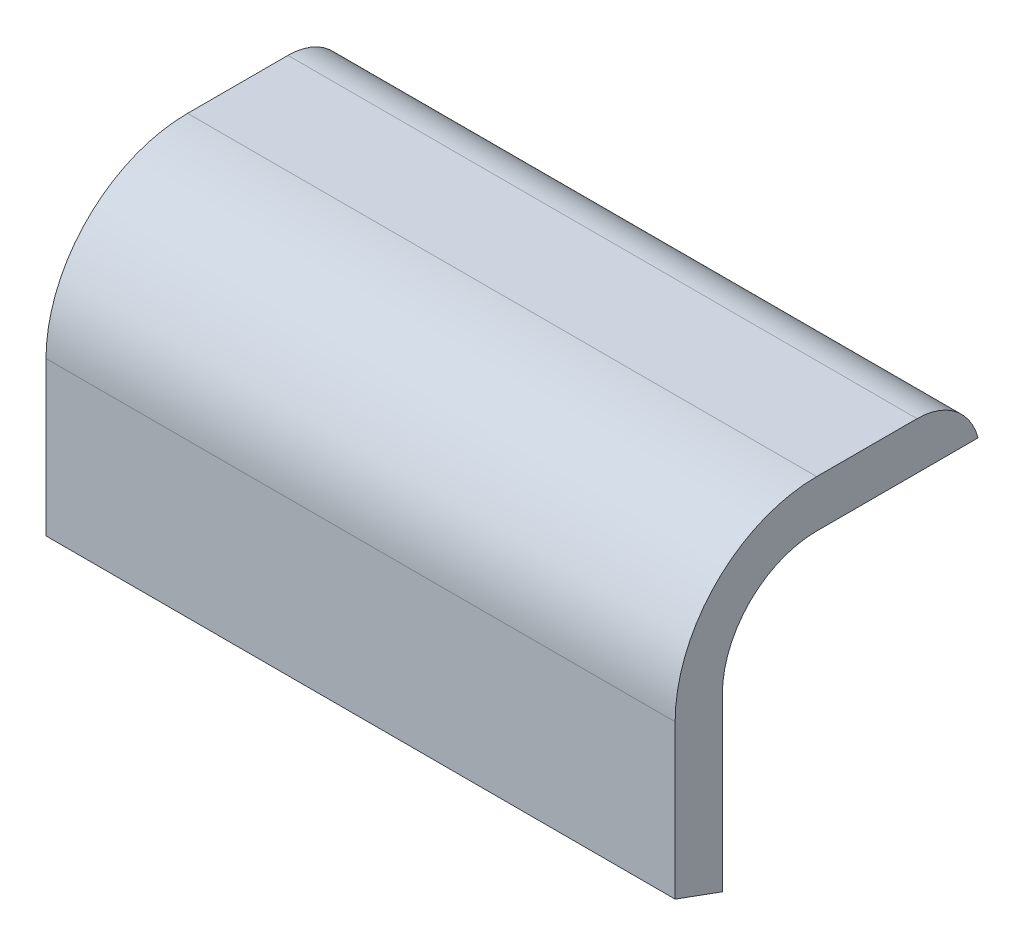
from build123d import *

# Parameters (mm, degrees)
SKETCH1_W           = 100
SKETCH1_H           = 40.64
BOSS_EXTRUDE1_DEPTH = 7.5
SKETCH2_W           = 100
SKETCH2_H           = 7.5
BOSS_EXTRUDE2_DEPTH = 46.92
BOSS_EXTRUDE3_DEPTH = 100
FILLET1_R           = 10
FILLET2_R           = 15
FILLET3_R           = 22.5


with BuildPart() as part:
    # Sketch1 → Boss-Extrude1 (new body)
    with BuildSketch(Plane(origin=(0, 0, 0), x_dir=(1, 0, 0), z_dir=(0, 1, 0))):
        Rectangle(SKETCH1_W, SKETCH1_H)
    extrude(amount=BOSS_EXTRUDE1_DEPTH)

    # Sketch2 → Boss-Extrude2 (add)
    with BuildSketch(Plane(origin=(0, 7.5, 0), x_dir=(1, 0, 0), z_dir=(0, 1, 0))):
        with Locations((0, -24.07)):
            Rectangle(SKETCH2_W, SKETCH2_H)
    extrude(amount=-BOSS_EXTRUDE2_DEPTH)

    # Sketch3 → Boss-Extrude3 (add)
    with BuildSketch(Plane.ZY.offset(50)):
        Polygon((20.32, -39.42), (20.32, -42.16), (27.82, -39.42), (27.82, -32.266971567), (20.32, -32.266971567), align=None)
    extrude(amount=-BOSS_EXTRUDE3_DEPTH)

    # Fillet1
    # the kernel refuses this fillet: 10 mm, written as the material it takes off along each edge
    with BuildSketch(Plane(origin=(-74.206145914, 7.5, -20.32), x_dir=(0, -1, 0), z_dir=(1, 0, 0))) as fillet1_piece_1:
        with BuildLine():
            CenterArc((10, -9.682458366), FILLET1_R, 104.477512186, 75.522487814)
            Line((0, -9.682458366), (-0.2, -9.682458366))
            Line((-0.2, -9.682458366), (-0.2, 0))
            Line((-0.2, 0), (0, 0.2))
            ThreePointArc((0, 0.2), (3.75, 0.2), (7.45, 0.193649167))
            Line((7.45, 0.193649167), (7.5, 0))
        make_face()
    extrude(amount=148.412291828, mode=Mode.SUBTRACT)

    # Fillet2
    fillet2_edges = [part.edges().sort_by_distance(p)[0] for p in [
        (0, 0, 20.32),
    ]]
    fillet(fillet2_edges, radius=FILLET2_R)

    # Fillet3
    fillet3_edges = [part.edges().sort_by_distance(p)[0] for p in [
        (0, 7.5, 27.82),
    ]]
    fillet(fillet3_edges, radius=FILLET3_R)


solid = part.part
